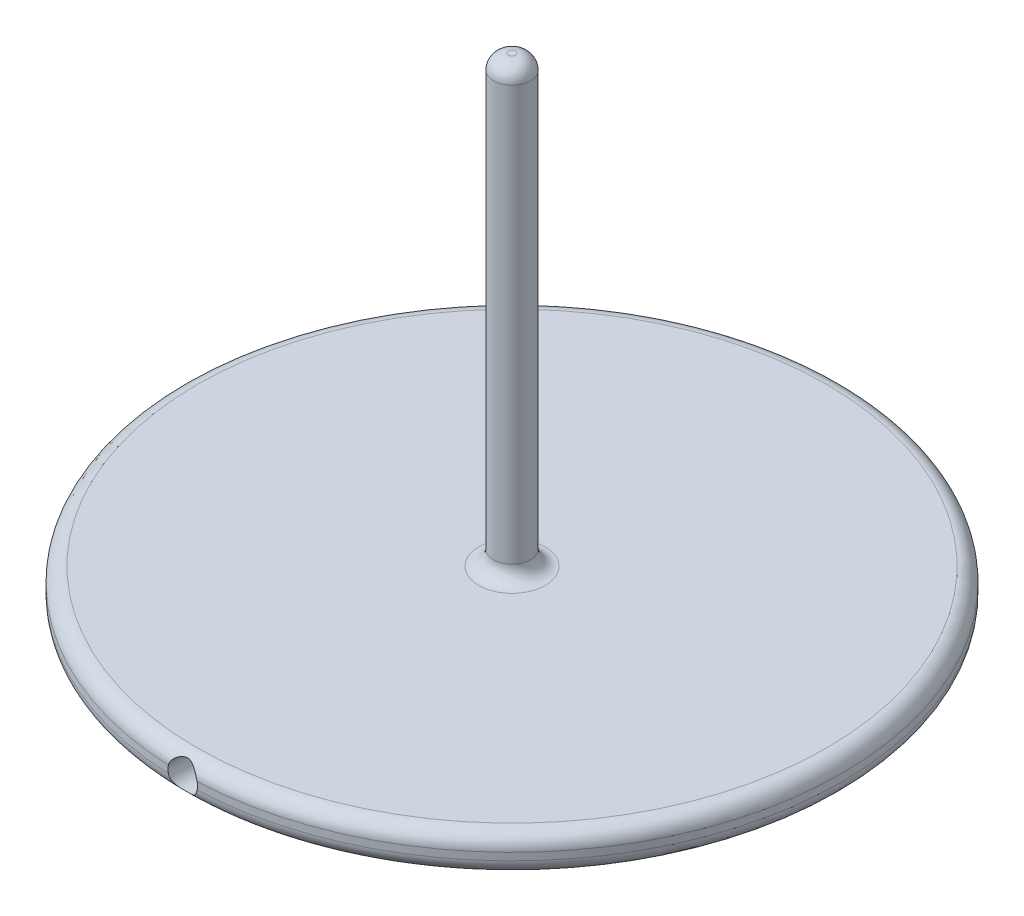
from build123d import *

# Parameters (mm, degrees)
SKETCH1_R           = 56.515
BOSS_EXTRUDE1_DEPTH = 6.35
SKETCH2_R           = 3.175
BOSS_EXTRUDE2_DEPTH = 76.2
SKETCH5_R           = 2.54
CUT_EXTRUDE1_DEPTH  = 25.4
FILLET2_R           = 2.54


with BuildPart() as part:
    # Sketch1 → Boss-Extrude1 (new body)
    with BuildSketch(Plane(origin=(0, 0, 0), x_dir=(1, 0, 0), z_dir=(0, 1, 0))):
        with Locations(Location((0, 0, 0), (0, 0, 270))):
            Circle(SKETCH1_R)
    extrude(amount=BOSS_EXTRUDE1_DEPTH)

    # Sketch2 → Boss-Extrude2 (add)
    with BuildSketch(Plane(origin=(0, 6.35, 0), x_dir=(1, 0, 0), z_dir=(0, 1, 0))):
        with Locations(Location((0, 0, 0), (0, 0, 90))):
            Circle(SKETCH2_R)
    extrude(amount=BOSS_EXTRUDE2_DEPTH)

    # Sketch5 → Cut-Extrude1 (cut)
    with BuildSketch(Plane.XY.offset(56.515)):
        with Locations((0, 3.175)):
            Circle(SKETCH5_R)
    extrude(amount=-CUT_EXTRUDE1_DEPTH, mode=Mode.SUBTRACT)

    # Fillet2
    # the kernel refuses this fillet: 2.54 mm, written as the material it adds along each edge
    with BuildSketch(Plane(origin=(0, 6.35, 0), x_dir=(0, 0, -1), z_dir=(1, 0, 0))) as fillet2_piece_1:
        with BuildLine():
            CenterArc((3.175 + FILLET2_R, FILLET2_R), FILLET2_R, 180, 90)
            Line((3.175, FILLET2_R), (3.175, 0))
            Line((3.175, 0), (3.175 + FILLET2_R, 0))
        make_face()
    revolve(axis=Axis((0, 6.35, 0), (0, 1, 0)))
    # the kernel refuses this fillet: 2.54 mm, written as the material it takes off along each edge
    with BuildSketch(Plane(origin=(0, 82.55, 0), x_dir=(0, 0, -1), z_dir=(1, 0, 0))) as fillet2_2_piece_1:
        with BuildLine():
            CenterArc((3.175 - FILLET2_R, -FILLET2_R), FILLET2_R, 0, 90)
            Line((3.175 - FILLET2_R, 0), (3.175, 0))
            Line((3.175, 0), (3.175, -FILLET2_R))
        make_face()
    revolve(axis=Axis((0, 82.55, 0), (0, 1, 0)), mode=Mode.SUBTRACT)
    with BuildSketch(Plane(origin=(0, 0, 0), x_dir=(0, 0, 1), z_dir=(-1, 0, 0))) as fillet2_2_piece_2:
        with BuildLine():
            CenterArc((56.515 - FILLET2_R, FILLET2_R), FILLET2_R, 270, 90)
            Line((56.515 - FILLET2_R, 0), (56.515, 0))
            Line((56.515, 0), (56.515, FILLET2_R))
        make_face()
    revolve(axis=Axis((0, 0, 0), (0, 1, 0)), mode=Mode.SUBTRACT)
    with BuildSketch(Plane(origin=(0, 6.35, 0), x_dir=(0, 0, 1), z_dir=(-1, 0, 0))) as fillet2_2_piece_3:
        with BuildLine():
            CenterArc((56.515 - FILLET2_R, -FILLET2_R), FILLET2_R, 0, 90)
            Line((56.515 - FILLET2_R, 0), (56.515, 0))
            Line((56.515, 0), (56.515, -FILLET2_R))
        make_face()
    revolve(axis=Axis((0, 6.35, 0), (0, 1, 0)), mode=Mode.SUBTRACT)


solid = part.part
